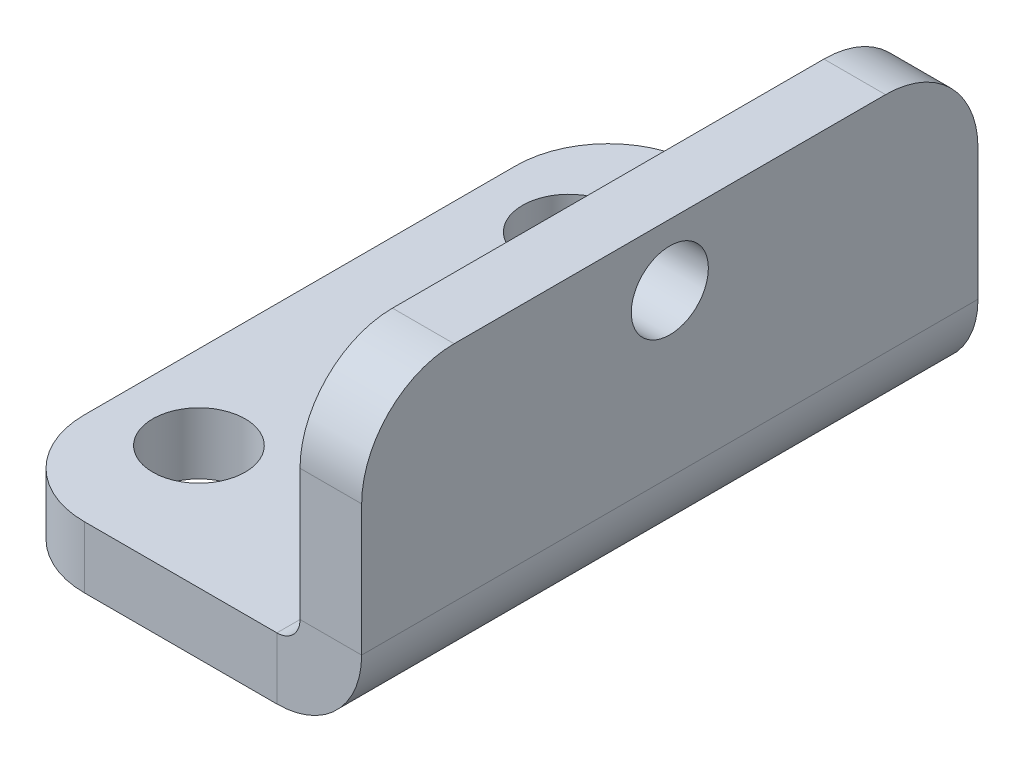
from build123d import *

# Parameters (mm, degrees)
SKETCH1_R                    = 1.5
BASE_FLANGE1_DEPTH           = 2
EDGE_FLANGE1_STRIP_W         = 9.5
EDGE_FLANGE1_STRIP_H         = 2
EDGE_FLANGE1_STRIP_CUT_DEPTH = 20
EDGE_FLANGE1_DEPTH           = 20
SKETCH9_R                    = 1.25
CUT_EXTRUDE1_DEPTH           = 10
FILLET1_R                    = 3


# Sheet-metal steps are written as plain solids
with BuildPart() as part:
    # Sketch1 → Base-Flange1 (new body)
    with BuildSketch(Plane(origin=(0, 0, 0), x_dir=(1, 0, 0), z_dir=(0, 1, 0))):
        with BuildLine():
            Line((0, 7), (0, -7))
            ThreePointArc((0, -7), (0.878679656, -9.121320344), (3, -10))
            Line((3, -10), (12, -10))
            Line((12, -10), (12, 10))
            Line((12, 10), (3, 10))
            ThreePointArc((3, 10), (0.878679656, 9.121320344), (0, 7))
        make_face()
        with Locations(Location((2.72, 6, 0), (0, 0, 270))):
            Circle(SKETCH1_R, mode=Mode.SUBTRACT)
        with Locations(Location((2.72, -6, 0), (0, 0, 270))):
            Circle(SKETCH1_R, mode=Mode.SUBTRACT)
    extrude(amount=BASE_FLANGE1_DEPTH)

    # Edge-Flange1 strip (across the edge) → Edge-Flange1 strip cut (cut)
    with BuildSketch(Plane(origin=(12, 2, 10), x_dir=(-1, 0, 0), z_dir=(0, 0, -1))):
        with Locations((-2, -1)):
            Rectangle(EDGE_FLANGE1_STRIP_W, EDGE_FLANGE1_STRIP_H)
    extrude(amount=EDGE_FLANGE1_STRIP_CUT_DEPTH, mode=Mode.SUBTRACT)

    # Edge-Flange1 section (across the edge) → Edge-Flange1 (add)
    with BuildSketch(Plane(origin=(12, 2, 10), x_dir=(-1, 0, 0), z_dir=(0, 0, -1))):
        with BuildLine():
            Line((0, 0.75), (0, 8))
            Line((0, 8), (2, 8))
            Line((2, 8), (2, 0.75))
            ThreePointArc((2, 0.75), (2.219669914, 0.219669914), (2.75, 0))
            Line((2.75, 0), (2.75, -2))
            ThreePointArc((2.75, -2), (0.805456352, -1.194543648), (0, 0.75))
        make_face()
    extrude(amount=EDGE_FLANGE1_DEPTH)

    # Sketch9 → Cut-Extrude1 (cut)
    with BuildSketch(Plane.ZY.offset(-10)):
        with Locations(Location((0, 8, 0), (0, 0, 270))):
            Circle(SKETCH9_R)
    extrude(amount=-CUT_EXTRUDE1_DEPTH, mode=Mode.SUBTRACT)

    # Fillet1
    fillet1_edges = [part.edges().sort_by_distance(p)[0] for p in [
        (11, 10, 10),
        (11, 10, -10),
    ]]
    fillet(fillet1_edges, radius=FILLET1_R)


solid = part.part
